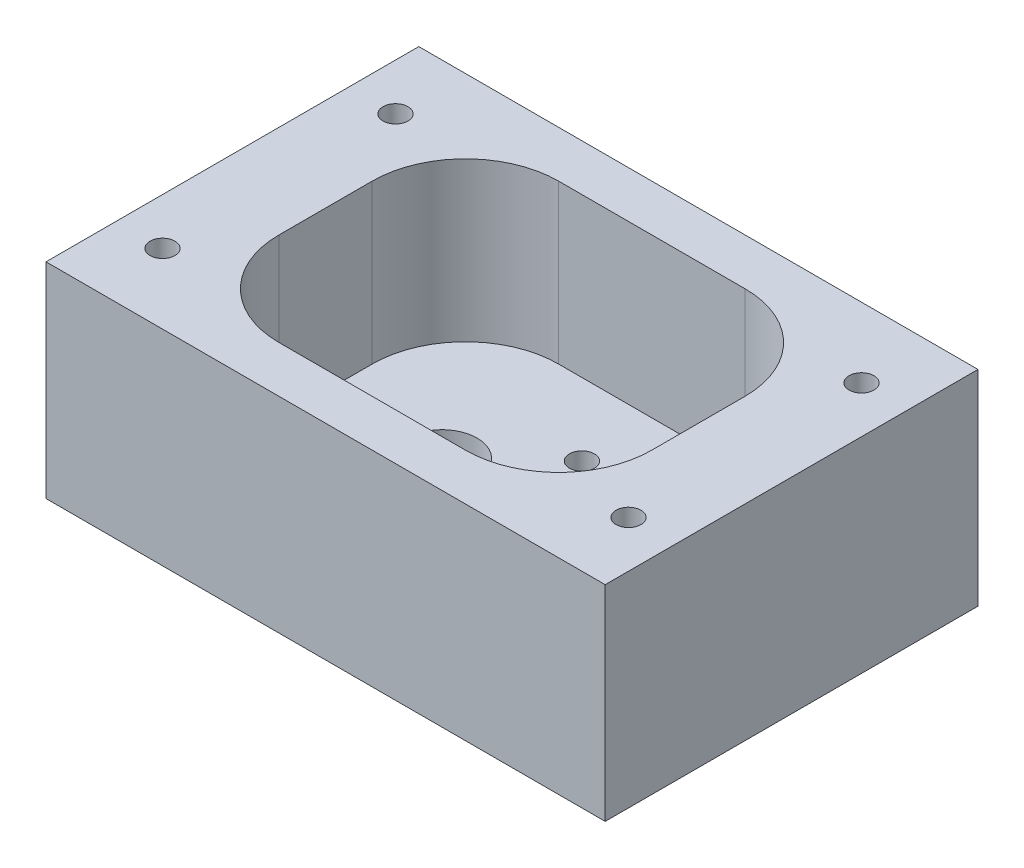
from build123d import *

# Parameters (mm, degrees)
SKETCH1_W            = 76.2
SKETCH1_H            = 50.8
BOSS_EXTRUDE1_DEPTH  = 27.94
SKETCH2_R            = 4.7625
SKETCH2_R_2          = 9
CUT_EXTRUDE1_DEPTH   = 54.641528688
CUT_EXTRUDE2_DEPTH   = 21.59
M3_CLEARANCE_HOLE1_D = 3.4


with BuildPart() as part:
    # Sketch1 → Boss-Extrude1 (new body)
    with BuildSketch(Plane(origin=(0, 0, 0), x_dir=(1, 0, 0), z_dir=(0, 1, 0))):
        Rectangle(SKETCH1_W, SKETCH1_H)
    extrude(amount=BOSS_EXTRUDE1_DEPTH)

    # Sketch2 → Cut-Extrude1 (cut, through all)
    with BuildSketch(Plane.XZ):
        with Locations((-9.525, 0)):
            Circle(SKETCH2_R)
        with Locations((9.525, 0)):
            Circle(SKETCH2_R_2)
    extrude(amount=-CUT_EXTRUDE1_DEPTH, mode=Mode.SUBTRACT)

    # Sketch3 → Cut-Extrude2 (cut)
    with BuildSketch(Plane(origin=(0, 27.94, 0), x_dir=(1, 0, 0), z_dir=(0, 1, 0))):
        with BuildLine():
            Line((-12.7, -19.05), (12.7, -19.05))
            ThreePointArc((12.7, -19.05), (21.680256121, -15.330256121), (25.4, -6.35))
            Line((25.4, -6.35), (25.4, 6.35))
            ThreePointArc((25.4, 6.35), (21.680256121, 15.330256121), (12.7, 19.05))
            Line((12.7, 19.05), (-12.7, 19.05))
            ThreePointArc((-12.7, 19.05), (-21.680256121, 15.330256121), (-25.4, 6.35))
            Line((-25.4, 6.35), (-25.4, -6.35))
            ThreePointArc((-25.4, -6.35), (-21.680256121, -15.330256121), (-12.7, -19.05))
        make_face()
    extrude(amount=-CUT_EXTRUDE2_DEPTH, mode=Mode.SUBTRACT)

    # M3 Clearance Hole1 (through all)
    with Locations(Plane(origin=(-31.75, 0, 15.875), x_dir=(0, 0, -1), z_dir=(0, -1, 0))):
        with Locations((0, 0), (31.75, 0), (6.682611845, 32.082611845), (25.067388155, 32.082611845), (6.682611845, 50.467388155), (25.067388155, 50.467388155), (0, 63.5), (31.75, 63.5)):
            Hole(M3_CLEARANCE_HOLE1_D / 2)


solid = part.part
